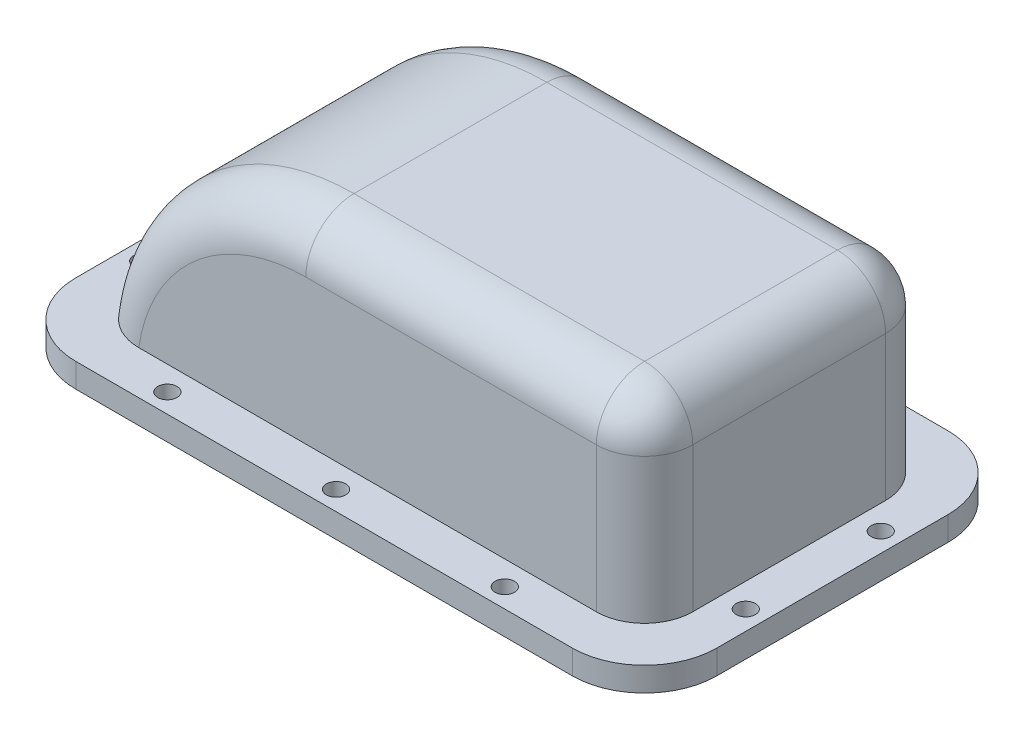
from build123d import *

# Parameters (mm, degrees)
SKETCH1_W               = 266
SKETCH1_H               = 156
BOSS_EXTRUDE1_DEPTH     = 10
SKETCH2_W               = 230
SKETCH2_H               = 80
BOSS_EXTRUDE2_DEPTH     = 60
FILLET1_R               = 90
FILLET2_R               = 20
CUT_EXTRUDE1_DEPTH      = 40
CUT_EXTRUDE1_DEPTH_BACK = 40
FILLET3_R               = 10
CUT_EXTRUDE2_REACH      = 225.886
SKETCH4_R               = 20
SKETCH5_W               = 69.5
SKETCH5_H               = 38.16369677
CUT_EXTRUDE3_DEPTH      = 18
SKETCH6_R               = 4
CUT_EXTRUDE4_DEPTH      = 179.530109674
FILLET4_R               = 30


with BuildPart() as part:
    # Sketch1 → Boss-Extrude1 (new body)
    with BuildSketch(Plane(origin=(0, 0, 0), x_dir=(1, 0, 0), z_dir=(0, 1, 0))):
        Rectangle(SKETCH1_W, SKETCH1_H)
    extrude(amount=BOSS_EXTRUDE1_DEPTH)

    # Sketch2 → Boss-Extrude2 (add, symmetric)
    with BuildSketch(Plane.XY):
        with Locations((0, 50)):
            Rectangle(SKETCH2_W, SKETCH2_H)
    extrude(amount=BOSS_EXTRUDE2_DEPTH, both=True)

    # Fillet1
    # the kernel refuses this fillet: 90 mm, written as the material it takes off along each edge
    with BuildSketch(Plane(origin=(-115, 90, -283.60679775), x_dir=(0, -1, 0), z_dir=(0, 0, 1))) as fillet1_piece_1:
        with BuildLine():
            CenterArc((90, 89.4427191), FILLET1_R, 180, 83.620629792)
            Line((0, 89.4427191), (-1.8, 89.4427191))
            Line((-1.8, 89.4427191), (-1.8, 0))
            Line((-1.8, 0), (0, -1.8))
            ThreePointArc((0, -1.8), (40, -1.8), (79.8, -1.788854382))
            Line((79.8, -1.788854382), (80, 0))
        make_face()
    extrude(amount=567.2135955, mode=Mode.SUBTRACT)

    # Fillet2
    fillet2_edges = [part.edges().sort_by_distance(p)[0] for p in [
        (115, 50, 60),
        (115, 90, 0),
        (115, 50, -60),
        (44.72135955, 90, -60),
        (-85.5572809, 67.082039325, -60),
        (44.72135955, 90, 60),
        (-85.5572809, 67.082039325, 60),
    ]]
    fillet(fillet2_edges, radius=FILLET2_R)

    # Sketch3 → Cut-Extrude1 (cut, two sides: drawn at the far end of the back side and taken through both)
    with BuildSketch(Plane.XY.offset(-CUT_EXTRUDE1_DEPTH_BACK)):
        with BuildLine():
            Line((-105.5572809, 0), (105, 0))
            Line((105, 0), (105, 60))
            ThreePointArc((105, 60), (99.142135624, 74.142135624), (85, 80))
            Line((85, 80), (-25.5572809, 80))
            ThreePointArc((-25.5572809, 80), (-82.125823395, 56.568542495), (-105.5572809, 0))
        make_face()
    extrude(amount=CUT_EXTRUDE1_DEPTH + CUT_EXTRUDE1_DEPTH_BACK, mode=Mode.SUBTRACT)

    # Fillet3
    fillet3_edges = [part.edges().sort_by_distance(p)[0] for p in [
        (99.142135624, 74.142135624, -40),
        (105, 30, -40),
        (-82.125823395, 56.568542495, -40),
        (29.72135955, 80, -40),
        (105, 30, 40),
        (99.142135624, 74.142135624, 40),
        (29.72135955, 80, 40),
        (-82.125823395, 56.568542495, 40),
    ]]
    fillet(fillet3_edges, radius=FILLET3_R)

    # Sketch4 → Cut-Extrude2 (cut, up to next)
    with BuildSketch(Plane(origin=(0, 0, -78), x_dir=(-1, 0, 0), z_dir=(0, 0, -1)), mode=Mode.PRIVATE) as cut_extrude2_sk1:
        with Locations((-5, -3)):
            Circle(SKETCH4_R)
    cut_extrude2_tool1 = extrude(cut_extrude2_sk1.sketch, amount=-CUT_EXTRUDE2_REACH, mode=Mode.PRIVATE) & part.part
    add(cut_extrude2_tool1.solids().sort_by_distance((5, -3, -78))[0], mode=Mode.SUBTRACT)

    # Sketch5 → Cut-Extrude3 (cut)
    with BuildSketch(Plane(origin=(0, 0, -78), x_dir=(-1, 0, 0), z_dir=(0, 0, -1))):
        with Locations((-5, 0)):
            Rectangle(SKETCH5_W, SKETCH5_H)
    extrude(amount=-CUT_EXTRUDE3_DEPTH, mode=Mode.SUBTRACT)

    # Sketch6 → Cut-Extrude4 (cut, through all)
    with BuildSketch(Plane.XZ):
        with Locations(Location((-125, -28, 0), (0, 0, 270))):
            Circle(SKETCH6_R)
        with Locations(Location((125, -28, 0), (0, 0, 270))):
            Circle(SKETCH6_R)
        with Locations(Location((125, 28, 0), (0, 0, 270))):
            Circle(SKETCH6_R)
        with Locations(Location((-125, 28, 0), (0, 0, 270))):
            Circle(SKETCH6_R)
        with Locations(Location((-73, -70, 0), (0, 0, 270))):
            Circle(SKETCH6_R)
        with Locations(Location((67, -70, 0), (0, 0, 270))):
            Circle(SKETCH6_R)
        with Locations(Location((-3, 70, 0), (0, 0, 270))):
            Circle(SKETCH6_R)
        with Locations(Location((67, 70, 0), (0, 0, 270))):
            Circle(SKETCH6_R)
        with Locations(Location((-73, 70, 0), (0, 0, 270))):
            Circle(SKETCH6_R)
    extrude(amount=-CUT_EXTRUDE4_DEPTH, mode=Mode.SUBTRACT)

    # Fillet4
    fillet4_edges = [part.edges().sort_by_distance(p)[0] for p in [
        (133, 5, 78),
        (-133, 5, 78),
        (-133, 5, -78),
        (133, 5, -78),
    ]]
    fillet(fillet4_edges, radius=FILLET4_R)


solid = part.part
